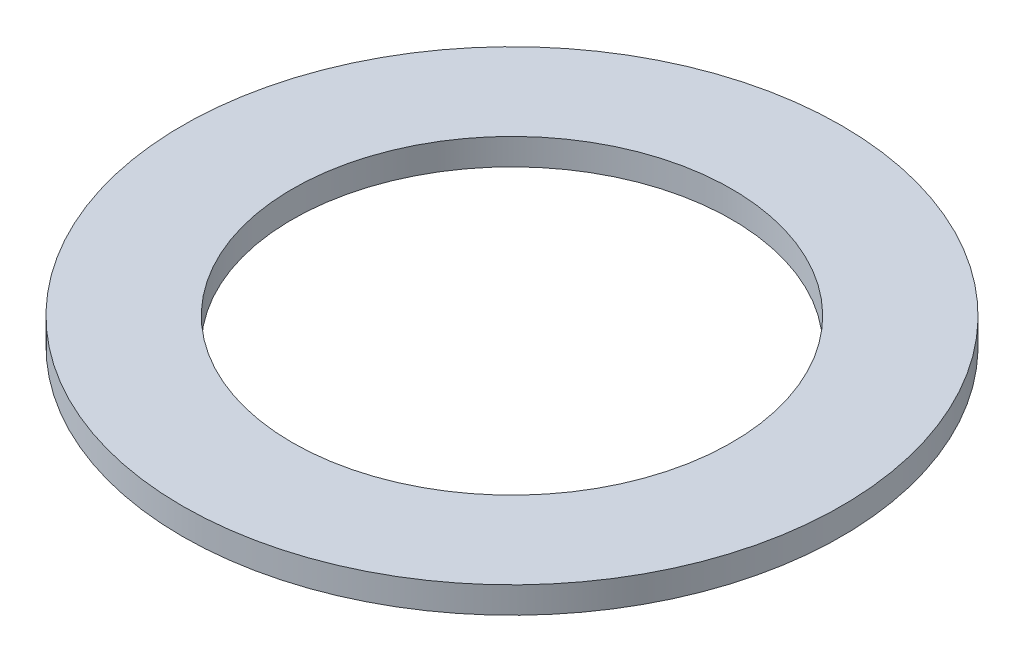
from build123d import *

# Parameters (mm, degrees)
SKETCH1_R           = 9.525
BOSS_EXTRUDE1_DEPTH = 0.762
SKETCH5_R           = 6.35
CUT_EXTRUDE1_DEPTH  = 14.491919582


with BuildPart() as part:
    # Sketch1 → Boss-Extrude1 (new body)
    with BuildSketch(Plane(origin=(0, 0, 0), x_dir=(1, 0, 0), z_dir=(0, 1, 0))):
        Circle(SKETCH1_R)
    extrude(amount=BOSS_EXTRUDE1_DEPTH)

    # Sketch5 → Cut-Extrude1 (cut, through all)
    with BuildSketch(Plane(origin=(0, 0.762, 0), x_dir=(-1, 0, 0), z_dir=(0, 1, 0))):
        Circle(SKETCH5_R)
    extrude(amount=-CUT_EXTRUDE1_DEPTH, mode=Mode.SUBTRACT)


solid = part.part
